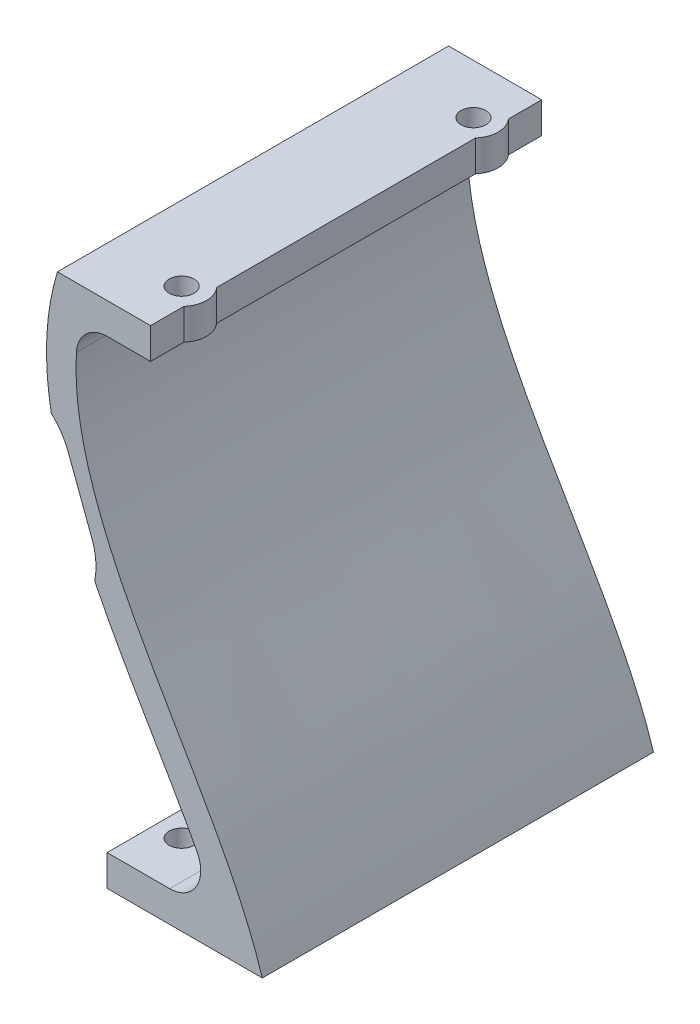
from build123d import *

# Parameters (mm, degrees)
BOSS_EXTRUDE1_DEPTH = 63
SKETCH12_W          = 10
SKETCH12_H          = 63
BOSS_EXTRUDE6_DEPTH = 5
BOSS_EXTRUDE7_DEPTH = 63
FILLET4_R           = 5
SKETCH14_R          = 2
CUT_EXTRUDE5_DEPTH  = 10
SKETCH15_R          = 4
SKETCH15_R_2        = 2
BOSS_EXTRUDE8_DEPTH = 5
SKETCH16_W          = 20
SKETCH16_H          = 63
BOSS_EXTRUDE9_DEPTH = 5
FILLET5_R           = 5
CUT_EXTRUDE6_START  = -5
SKETCH17_R          = 2
CUT_EXTRUDE6_DEPTH  = 5
CUT_EXTRUDE7_DEPTH  = 80
FILLET6_R           = 10


# Read off the part's stored shape, not the designer's step: Boss-Extrude1
with BuildPart() as part:
    # Boss-Extrude1 outline → Boss-Extrude1 (new body)
    with BuildSketch(Plane.XY):
        with BuildLine():
            Line((4.954113003, -60.810475982), (9.954113003, -60.810475982))
            add(Edge.make_bspline(
                [(9.954113003, -60.810475982), (1.787820041, -34.566500255), (-27.991304854, -7.282060069), (-18.045886997, 21.189524018)],
                knots=[0, 0, 0, 0, 1, 1, 1, 1], degree=3))
            Line((-18.045886997, 21.189524018), (-23.045886997, 21.189524018))
            add(Edge.make_bspline(
                [(-23.045886997, 21.189524018), (-23.192896954, 20.707388184), (-23.619107908, 19.21203202), (-24.398456673, 15.722733579), (-24.92594246, 10.71547172), (-24.705924446, 4.806399572), (-23.443795498, -2.907918287), (-20.364970108, -12.213873941), (-15.162719206, -22.926775882), (-9.22446855, -33.283941227), (-4.27318175, -41.652306471), (-0.670405229, -48.178299158), (1.765142475, -52.980809676), (3.499618766, -56.88928979), (4.492016037, -59.486726266), (4.856824136, -60.525956387), (4.954113003, -60.810475982)],
                knots=[0.016302379, 0.016302379, 0.016302379, 0.016302379, 0.03125, 0.0625, 0.125, 0.1875, 0.25, 0.375, 0.5, 0.625, 0.75, 0.8125, 0.875, 0.9375, 0.96875, 0.980543141, 0.980543141, 0.980543141, 0.980543141], degree=3))
        make_face()
    extrude(amount=BOSS_EXTRUDE1_DEPTH)



with BuildPart() as body_2:
    # Sketch12 → Boss-Extrude6 (new body)
    with BuildSketch(Plane(origin=(0, 21.189524018, 0), x_dir=(1, 0, 0), z_dir=(0, 1, 0))):
        with Locations((-13.045886997, -31.5)):
            Rectangle(SKETCH12_W, SKETCH12_H)
    extrude(amount=-BOSS_EXTRUDE6_DEPTH)


with BuildPart() as part_1:
    add(part.part)

    add(body_2.part)  # Boss-Extrude7 merges body 2
    # Sketch13 → Boss-Extrude7 (add)
    with BuildSketch(Plane.XY.offset(63)):
        with BuildLine():
            Line((-18.045886997, 16.189524018), (-18.045886997, 21.189524018))
            add(Edge.make_bspline(
                [(-19.398734896, 16.189524018), (-19.076313221, 17.852122544), (-18.629495341, 19.518779331), (-18.045886997, 21.189524018)],
                knots=[0.941318871, 0.941318871, 0.941318871, 0.941318871, 1, 1, 1, 1], degree=3))
            Line((-19.398734896, 16.189524018), (-18.045886997, 16.189524018))
        make_face()
    extrude(amount=-BOSS_EXTRUDE7_DEPTH)

    # Fillet4
    fillet4_edges = [part_1.edges().sort_by_distance(p)[0] for p in [
        (-19.398734896, 16.189524018, 31.5),
    ]]
    fillet(fillet4_edges, radius=FILLET4_R)

    # Sketch14 → Cut-Extrude5 (cut)
    with BuildSketch(Plane.XZ.offset(-16.189524018)):
        with Locations((-11.045886997, 8)):
            Circle(SKETCH14_R)
        with Locations((-11.045886997, 55)):
            Circle(SKETCH14_R)
    extrude(amount=-CUT_EXTRUDE5_DEPTH, mode=Mode.SUBTRACT)

    # Sketch15 → Boss-Extrude8 (add)
    # profile 1 of 2: a face of its own
    with BuildSketch(Plane.XZ.offset(-16.189524018)):
        with Locations((-11.045886997, 55)):
            Circle(SKETCH15_R)
        with Locations((-11.045886997, 55)):
            Circle(SKETCH15_R_2, mode=Mode.SUBTRACT)
    # profile 2 of 2: a face of its own
    with BuildSketch(Plane.XZ.offset(-16.189524018)):
        with Locations((-11.045886997, 8)):
            Circle(SKETCH15_R)
        with Locations((-11.045886997, 8)):
            Circle(SKETCH15_R_2, mode=Mode.SUBTRACT)
    extrude(amount=-BOSS_EXTRUDE8_DEPTH)

    # Sketch16 → Boss-Extrude9 (add)
    with BuildSketch(Plane.XZ.offset(60.810475982)):
        with Locations((-5.045886997, 31.5)):
            Rectangle(SKETCH16_W, SKETCH16_H)
    extrude(amount=-BOSS_EXTRUDE9_DEPTH)

    # Fillet5
    fillet5_edges = [part_1.edges().sort_by_distance(p)[0] for p in [
        (3.003762593, -55.810475982, 31.5),
    ]]
    fillet(fillet5_edges, radius=FILLET5_R)

    # Sketch17 → Cut-Extrude6 (cut)
    with BuildSketch(Plane(origin=(0, -55.810475982, 0), x_dir=(1, 0, 0), z_dir=(0, 1, 0)).offset(CUT_EXTRUDE6_START)):
        with Locations((-11.045886997, -55)):
            Circle(SKETCH17_R)
        with Locations((-11.045886997, -8)):
            Circle(SKETCH17_R)
    extrude(amount=CUT_EXTRUDE6_DEPTH, mode=Mode.SUBTRACT)

    # Sketch18 → Cut-Extrude7 (cut)
    with BuildSketch(Plane(origin=(0, 0, 0), x_dir=(-1, 0, 0), z_dir=(0, 0, -1))):
        Polygon((23.045886997, 1.542241973), (27.88763941, -1.261096589), (21.516415404, -20.247344126), (15.527464839, -18.463401404), align=None)
    extrude(amount=-CUT_EXTRUDE7_DEPTH, mode=Mode.SUBTRACT)

    # Fillet6
    # the kernel refuses this fillet: 10 mm, written as the material it adds along each edge
    with BuildSketch(Plane(origin=(-15.527464839, -18.463401404, 0), x_dir=(-0.958385683586268, -0.28547658660016567, 0), z_dir=(0, 0, 1))) as fillet6_piece_1:
        with BuildLine():
            CenterArc((10.361821719, -4.811763892), FILLET6_R, 151.237737935, 32.771900007)
            Line((0.386298698, -5.51100666), (0.186788237, -5.524991515))
            Line((0.186788237, -5.524991515), (-0.19951046, -0.013984855))
            Line((-0.19951046, -0.013984855), (0, 0.2))
            ThreePointArc((0, 0.2), (0.797791872, 0.2), (1.420258984, 0.096235278))
            Line((1.420258984, 0.096235278), (1.595583743, 0))
        make_face()
    extrude(amount=63)
    with BuildSketch(Plane(origin=(-23.045886997, 1.542241973, 0), x_dir=(0.35179225201059605, -0.9360781011354306, 0), z_dir=(0, 0, 1))) as fillet6_piece_2:
        with BuildLine():
            CenterArc((4.818055228, -10), FILLET6_R, 90, 27.571489076)
            Line((0.189505284, -1.1356599), (0.096934285, -0.958373098))
            ThreePointArc((0.096934285, -0.958373098), (-0.102519699, -0.600748389), (-0.197272341, -0.032918439))
            Line((-0.197272341, -0.032918439), (0, 0.2))
            Line((0, 0.2), (4.818055228, 0.2))
            Line((4.818055228, 0.2), (4.818055228, 0))
        make_face()
    extrude(amount=63)


solid = part_1.part
